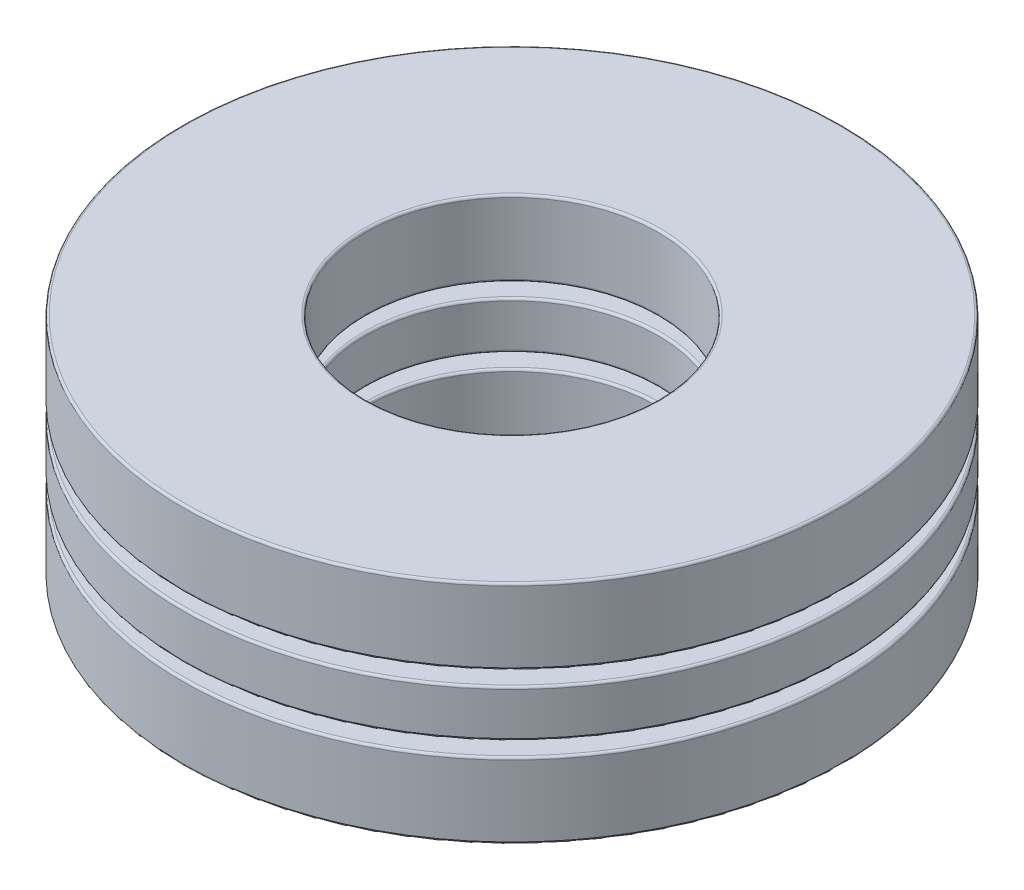
from build123d import *

# Parameters (mm, degrees)
SKETCH1_W         = 3.96875
SKETCH1_H         = 1.021291666
CIRPATTERN1_COUNT = 7
CIRPATTERN1_ANGLE = 308.571428571
CIRPATTERN2_COUNT = 7
SKETCH4_W         = 3.96875
SKETCH4_H         = 1.634066667
FILLET1_R         = 0.049022
FILLET2_R         = 0.049022
FILLET3_R         = 0.049022


with BuildPart() as part:
    # Sketch1 → Revolve1 (revolve)
    with BuildSketch(Plane(origin=(0, 0, 0), x_dir=(0, 0, -1), z_dir=(1, 0, 0))):
        with Locations((-5.159375, 0)):
            Rectangle(SKETCH1_W, SKETCH1_H)
    revolve(axis=Axis((0, -2.4511, 0), (0, 1, 0)))

    # Sketch3 → Cut-Revolve1 (revolve, cut)
    with BuildSketch(Plane(origin=(0, 0, 0), x_dir=(0, 0, -1), z_dir=(1, 0, 0))):
        with BuildLine():
            Line((-5.159375, 0.817033333), (-5.159375, -0.817033333))
            ThreePointArc((-5.159375, -0.817033333), (-5.976408333, 0), (-5.159375, 0.817033333))
        make_face()
    cut_revolve1 = revolve(axis=Axis((0, 0.817033333, 5.159375), (0, -1, 0)), mode=Mode.SUBTRACT)

    # CirPattern2: Cut-Revolve1 ×7 about axis
    cirpattern2_axis = Axis((0, 2.4511, 0), (0, -1, 0))
    for i in range(1, CIRPATTERN2_COUNT):
        add(cut_revolve1.rotate(cirpattern2_axis, i * 360 / CIRPATTERN2_COUNT), mode=Mode.SUBTRACT)

    # Fillet2
    fillet2_edges = [part.edges().sort_by_distance(p)[0] for p in [
        (0, -0.510645833, -3.175),
        (0, 0.510645833, -3.175),
        (0, -0.510645833, -7.14375),
        (0, 0.510645833, -7.14375),
    ]]
    fillet(fillet2_edges, radius=FILLET2_R)


with BuildPart() as body_2:
    # Sketch2 → Revolve2 (revolve)
    with BuildSketch(Plane(origin=(0, 0, 0), x_dir=(0, 0, -1), z_dir=(1, 0, 0))):
        with BuildLine():
            Line((-5.159375, 0.817033333), (-5.159375, -0.817033333))
            ThreePointArc((-5.159375, -0.817033333), (-5.976408333, 0), (-5.159375, 0.817033333))
        make_face()
    revolve(axis=Axis((0, 0.817033333, 5.159375), (0, -1, 0)))


with BuildPart() as cirpattern1_1:
    # CirPattern1: pattern copy
    add(body_2.part.rotate(Axis((0, 2.4511, 0), (0, -1, 0)), 1 * CIRPATTERN1_ANGLE / (CIRPATTERN1_COUNT - 1)))


with BuildPart() as cirpattern1_2:
    # CirPattern1: pattern copy
    add(body_2.part.rotate(Axis((0, 2.4511, 0), (0, -1, 0)), 2 * CIRPATTERN1_ANGLE / (CIRPATTERN1_COUNT - 1)))


with BuildPart() as cirpattern1_3:
    # CirPattern1: pattern copy
    add(body_2.part.rotate(Axis((0, 2.4511, 0), (0, -1, 0)), 3 * CIRPATTERN1_ANGLE / (CIRPATTERN1_COUNT - 1)))


with BuildPart() as cirpattern1_4:
    # CirPattern1: pattern copy
    add(body_2.part.rotate(Axis((0, 2.4511, 0), (0, -1, 0)), 4 * CIRPATTERN1_ANGLE / (CIRPATTERN1_COUNT - 1)))


with BuildPart() as cirpattern1_5:
    # CirPattern1: pattern copy
    add(body_2.part.rotate(Axis((0, 2.4511, 0), (0, -1, 0)), 5 * CIRPATTERN1_ANGLE / (CIRPATTERN1_COUNT - 1)))


with BuildPart() as cirpattern1_6:
    # CirPattern1: pattern copy
    add(body_2.part.rotate(Axis((0, 2.4511, 0), (0, -1, 0)), 6 * CIRPATTERN1_ANGLE / (CIRPATTERN1_COUNT - 1)))


with BuildPart() as body_9:
    # Sketch4 → Revolve3 (revolve)
    with BuildSketch(Plane(origin=(0, 0, 0), x_dir=(0, 0, -1), z_dir=(1, 0, 0))):
        with Locations((-5.159375, 1.634066667)):
            Rectangle(SKETCH4_W, SKETCH4_H)
        with Locations((-5.159375, -1.634066667)):
            Rectangle(SKETCH4_W, SKETCH4_H)
    revolve(axis=Axis((0, -2.4511, 0), (0, 1, 0)))

    # Fillet1
    fillet1_edges = [body_9.edges().sort_by_distance(p)[0] for p in [
        (0, 0.817033333, -3.175),
        (0, 2.4511, -3.175),
        (0, 0.817033333, -7.14375),
        (0, 2.4511, -7.14375),
    ]]
    fillet(fillet1_edges, radius=FILLET1_R)

    # Fillet3
    fillet3_edges = [body_9.edges().sort_by_distance(p)[0] for p in [
        (0, -2.4511, -3.175),
        (0, -0.817033333, -3.175),
        (0, -2.4511, -7.14375),
        (0, -0.817033333, -7.14375),
    ]]
    fillet(fillet3_edges, radius=FILLET3_R)


solid = Compound([part.part, body_2.part, cirpattern1_1.part, cirpattern1_2.part, cirpattern1_3.part, cirpattern1_4.part, cirpattern1_5.part, cirpattern1_6.part, body_9.part])
